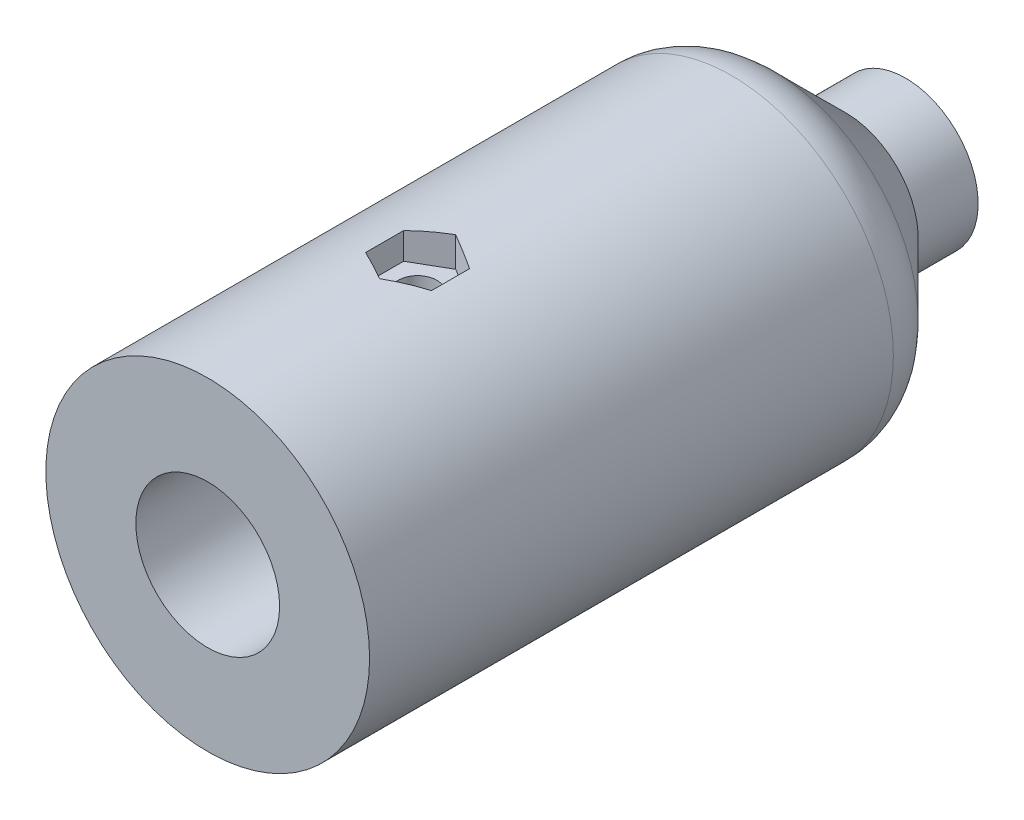
from build123d import *

# Parameters (mm, degrees)
SKETCH1_R                 = 11.05
SKETCH1_R_2               = 6.05
BOSS_EXTRUDE1_DEPTH       = 10
SKETCH2_R                 = 6.05
BOSS_EXTRUDE2_DEPTH       = 15
BOSS_EXTRUDE3_START       = 5
SKETCH3_R                 = 11.05
BOSS_EXTRUDE3_DEPTH       = 5
CHAMFER1_SIZE             = 5
SKETCH4_R                 = 6.05
SKETCH4_R_2               = 5.995
BOSS_EXTRUDE4_DEPTH       = 10
SKETCH5_R                 = 11.05
SKETCH5_R_2               = 5.995
BOSS_EXTRUDE5_DEPTH       = 28.2
SKETCH6_R                 = 11.05
BOSS_EXTRUDE6_DEPTH       = 18.2
CUT_EXTRUDE1_DEPTH        = 2.5
SKETCH8_R                 = 2.1
CUT_EXTRUDE2_DEPTH        = 56.44767804
SKETCH9_R                 = 2.8
CUT_EXTRUDE3_DEPTH        = 3.2
CUT_EXTRUDE4_START        = -3.2
SKETCH10_R                = 6.05
CUT_EXTRUDE4_DEPTH        = 3.2
CUT_EXTRUDE5_START        = -1.8
SKETCH11_R                = 6.05
CUT_EXTRUDE5_DEPTH        = 1.8
CUT_EXTRUDE6_DEPTH        = 42.272811874
CUT_EXTRUDE6_DEPTH_BACK   = 42.272811874
CUT_EXTRUDE7_START        = 8.5
CUT_EXTRUDE7_OUTLINE_R    = 1.6
CUT_EXTRUDE7_DEPTH        = 2.55
CUT_EXTRUDE8_START        = -11.050000102
CUT_EXTRUDE8_OUTLINE_R    = 2.75
CUT_EXTRUDE8_OUTLINE_R_2  = 1.6
CUT_EXTRUDE8_DEPTH        = 2.550000102
BOSS_EXTRUDE8_REACH       = 52.67
SKETCH15_R                = 13.5
SKETCH15_R_2              = 5.995
CUT_EXTRUDE9_DEPTH        = 43.705269085
CUT_EXTRUDE9_DEPTH_BACK   = 43.705269085
CUT_EXTRUDE10_START       = 11
CUT_EXTRUDE10_OUTLINE_R   = 1.6
CUT_EXTRUDE10_DEPTH       = 2.5
CUT_EXTRUDE11_START       = -13.500000102
CUT_EXTRUDE11_OUTLINE_R   = 2.75
CUT_EXTRUDE11_OUTLINE_R_2 = 1.6
CUT_EXTRUDE11_DEPTH       = 2.500000102
FILLET3_R                 = 5
SKETCH16_R                = 13.5
SKETCH16_R_2              = 5.995
BOSS_EXTRUDE9_DEPTH       = 10
SKETCH17_R                = 5.995
BOSS_EXTRUDE10_DEPTH      = 1.8
SKETCH19_R                = 2.1
BOSS_EXTRUDE12_DEPTH      = 1.25


# Read off the part's stored shape, not the designer's step: Cut-Extrude7, Cut-Extrude8, Cut-Extrude10, Cut-Extrude11
with BuildPart() as part:
    # Sketch1 → Boss-Extrude1 (new body)
    with BuildSketch(Plane.XY):
        Circle(SKETCH1_R)
        Circle(SKETCH1_R_2, mode=Mode.SUBTRACT)
    extrude(amount=BOSS_EXTRUDE1_DEPTH)



with BuildPart() as body_2:
    # Sketch2 → Boss-Extrude2 (new body)
    with BuildSketch(Plane(origin=(0, 0, 0), x_dir=(-1, 0, 0), z_dir=(0, 0, -1))):
        with Locations(Location((0, 0, 0), (0, 0, 180))):
            Circle(SKETCH2_R)
    extrude(amount=BOSS_EXTRUDE2_DEPTH)


with BuildPart() as part_1:
    add(part.part)

    add(body_2.part)  # Boss-Extrude3 merges body 2
    # Sketch3 → Boss-Extrude3 (add)
    with BuildSketch(Plane(origin=(0, 0, 0), x_dir=(-1, 0, 0), z_dir=(0, 0, -1)).offset(BOSS_EXTRUDE3_START)):
        Circle(SKETCH3_R)
    extrude(amount=-BOSS_EXTRUDE3_DEPTH)

    # Chamfer1
    chamfer1_edges = [part_1.edges().sort_by_distance(p)[0] for p in [
        (11.05, 0, -5),
    ]]
    chamfer(chamfer1_edges, length=CHAMFER1_SIZE - 0.0001)  # a hair under: the kernel refuses the full size

    # Sketch4 → Boss-Extrude4 (add)
    with BuildSketch(Plane.XY.offset(10)):
        with Locations(Location((0, 0, 0), (0, 0, 180))):
            Circle(SKETCH4_R)
        Circle(SKETCH4_R_2, mode=Mode.SUBTRACT)
    extrude(amount=-BOSS_EXTRUDE4_DEPTH)

    # Sketch5 → Boss-Extrude5 (add)
    with BuildSketch(Plane.XY.offset(10)):
        with Locations(Location((0, 0, 0), (0, 0, 180))):
            Circle(SKETCH5_R)
        Circle(SKETCH5_R_2, mode=Mode.SUBTRACT)
    extrude(amount=BOSS_EXTRUDE5_DEPTH)

    # Sketch6 → Boss-Extrude6 (add)
    with BuildSketch(Plane.XY):
        with Locations(Location((0, 0, 0), (0, 0, 180))):
            Circle(SKETCH6_R)
    extrude(amount=BOSS_EXTRUDE6_DEPTH)

    # Sketch7 → Cut-Extrude1 (cut)
    with BuildSketch(Plane.XY.offset(18.2)):
        Polygon((0, 4.041451884), (-3.5, 2.020725942), (-3.5, -2.020725942), (0, -4.041451884), (3.5, -2.020725942), (3.5, 2.020725942), align=None)
    extrude(amount=-CUT_EXTRUDE1_DEPTH, mode=Mode.SUBTRACT)

    # Sketch8 → Cut-Extrude2 (cut, through all)
    with BuildSketch(Plane(origin=(0, 0, -15), x_dir=(-1, 0, 0), z_dir=(0, 0, -1))):
        Circle(SKETCH8_R)
    extrude(amount=-CUT_EXTRUDE2_DEPTH, mode=Mode.SUBTRACT)

    # Sketch9 → Cut-Extrude3 (cut)
    with BuildSketch(Plane(origin=(0, 0, -15), x_dir=(-1, 0, 0), z_dir=(0, 0, -1))):
        Circle(SKETCH9_R)
    extrude(amount=-CUT_EXTRUDE3_DEPTH, mode=Mode.SUBTRACT)

    # Sketch10 → Cut-Extrude4 (cut)
    with BuildSketch(Plane(origin=(0, 0, -15), x_dir=(-1, 0, 0), z_dir=(0, 0, -1)).offset(CUT_EXTRUDE4_START)):
        Circle(SKETCH10_R)
    extrude(amount=CUT_EXTRUDE4_DEPTH, mode=Mode.SUBTRACT)

    # Sketch11 → Cut-Extrude5 (cut)
    with BuildSketch(Plane(origin=(0, 0, -11.8), x_dir=(-1, 0, 0), z_dir=(0, 0, -1)).offset(CUT_EXTRUDE5_START)):
        Circle(SKETCH11_R)
    extrude(amount=CUT_EXTRUDE5_DEPTH, mode=Mode.SUBTRACT)

    # Sketch12 → Cut-Extrude6 (cut, two sides: drawn at the far end of the back side and taken through both)
    with BuildSketch(Plane(origin=(0, 0, 0), x_dir=(1, 0, 0), z_dir=(0, 1, 0)).offset(-CUT_EXTRUDE6_DEPTH_BACK)):
        with BuildLine():
            ThreePointArc((-1.6, -30.7), (-1.13137085, -31.83137085), (0, -32.3))
            Line((0, -32.3), (0, -30.7))
            Line((0, -30.7), (-1.6, -30.7))
        make_face()
        with BuildLine():
            Line((0, -30.7), (0, -32.3))
            ThreePointArc((0, -32.3), (1.13137085, -31.83137085), (1.6, -30.7))
            Line((1.6, -30.7), (0, -30.7))
        make_face()
        with BuildLine():
            ThreePointArc((0, -29.1), (-1.13137085, -29.56862915), (-1.6, -30.7))
            Line((-1.6, -30.7), (0, -30.7))
            Line((0, -30.7), (0, -29.1))
        make_face()
        with BuildLine():
            Line((0, -29.1), (0, -30.7))
            Line((0, -30.7), (1.6, -30.7))
            ThreePointArc((1.6, -30.7), (1.13137085, -29.56862915), (0, -29.1))
        make_face()
    extrude(amount=CUT_EXTRUDE6_DEPTH + CUT_EXTRUDE6_DEPTH_BACK, mode=Mode.SUBTRACT)

    # Cut-Extrude7 outline → Cut-Extrude7 (cut)
    with BuildSketch(Plane(origin=(0, 0, 0), x_dir=(1, 0, 0), z_dir=(0, 1, 0)).offset(CUT_EXTRUDE7_START)):
        Polygon((2.75, -29.11228676), (0, -27.524573519), (-2.75, -29.11228676), (-2.75, -32.28771324), (0, -33.875426481), (2.75, -32.28771324), align=None)
        with Locations((0, -30.7)):
            Circle(CUT_EXTRUDE7_OUTLINE_R, mode=Mode.SUBTRACT)
    extrude(amount=CUT_EXTRUDE7_DEPTH, mode=Mode.SUBTRACT)

    # Cut-Extrude8 outline → Cut-Extrude8 (cut)
    with BuildSketch(Plane(origin=(0, 0, 0), x_dir=(1, 0, 0), z_dir=(0, 1, 0)).offset(CUT_EXTRUDE8_START)):
        with Locations((0, -30.7)):
            Circle(CUT_EXTRUDE8_OUTLINE_R)
        with Locations((0, -30.7)):
            Circle(CUT_EXTRUDE8_OUTLINE_R_2, mode=Mode.SUBTRACT)
    extrude(amount=CUT_EXTRUDE8_DEPTH, mode=Mode.SUBTRACT)

    # Boss-Extrude8: up to this cone (the profile starts inside it)
    boss_extrude8_end = Plane(origin=(0, 0, 38.2), z_dir=(0, 0, 1)).offset(-49.249999) * Cone(1e-06, 151.67, 151.669999, align=(Align.CENTER, Align.CENTER, Align.MIN), mode=Mode.PRIVATE)
    # Sketch15 → Boss-Extrude8 (add, up to the surface)
    with BuildSketch(Plane.XY.offset(38.2), mode=Mode.PRIVATE) as boss_extrude8_sk1:
        Circle(SKETCH15_R)
        Circle(SKETCH15_R_2, mode=Mode.SUBTRACT)
    boss_extrude8_tool1 = extrude(boss_extrude8_sk1.sketch, amount=-BOSS_EXTRUDE8_REACH, mode=Mode.PRIVATE) & boss_extrude8_end
    add(boss_extrude8_tool1.solids().sort_by_distance((-13.118162, 0, 38.2))[0])

    # Sketch12<4> → Cut-Extrude9 (cut, two sides: drawn at the far end of the back side and taken through both)
    with BuildSketch(Plane(origin=(0, 0, 0), x_dir=(1, 0, 0), z_dir=(0, 1, 0)).offset(-CUT_EXTRUDE9_DEPTH_BACK)):
        with BuildLine():
            ThreePointArc((-1.6, -30.7), (-1.13137085, -31.83137085), (0, -32.3))
            Line((0, -32.3), (0, -30.7))
            Line((0, -30.7), (-1.6, -30.7))
        make_face()
        with BuildLine():
            Line((0, -30.7), (0, -32.3))
            ThreePointArc((0, -32.3), (1.13137085, -31.83137085), (1.6, -30.7))
            Line((1.6, -30.7), (0, -30.7))
        make_face()
        with BuildLine():
            ThreePointArc((0, -29.1), (-1.13137085, -29.56862915), (-1.6, -30.7))
            Line((-1.6, -30.7), (0, -30.7))
            Line((0, -30.7), (0, -29.1))
        make_face()
        with BuildLine():
            Line((0, -29.1), (0, -30.7))
            Line((0, -30.7), (1.6, -30.7))
            ThreePointArc((1.6, -30.7), (1.13137085, -29.56862915), (0, -29.1))
        make_face()
    extrude(amount=CUT_EXTRUDE9_DEPTH + CUT_EXTRUDE9_DEPTH_BACK, mode=Mode.SUBTRACT)

    # Cut-Extrude10 outline → Cut-Extrude10 (cut)
    with BuildSketch(Plane(origin=(0, 0, 0), x_dir=(1, 0, 0), z_dir=(0, 1, 0)).offset(CUT_EXTRUDE10_START)):
        Polygon((-2.75, -32.28771324), (0, -33.875426481), (2.75, -32.28771324), (2.75, -29.11228676), (0, -27.524573519), (-2.75, -29.11228676), align=None)
        with Locations((0, -30.7)):
            Circle(CUT_EXTRUDE10_OUTLINE_R, mode=Mode.SUBTRACT)
    extrude(amount=CUT_EXTRUDE10_DEPTH, mode=Mode.SUBTRACT)

    # Cut-Extrude11 outline → Cut-Extrude11 (cut)
    with BuildSketch(Plane(origin=(0, 0, 0), x_dir=(1, 0, 0), z_dir=(0, 1, 0)).offset(CUT_EXTRUDE11_START)):
        with Locations((0, -30.7)):
            Circle(CUT_EXTRUDE11_OUTLINE_R)
        with Locations((0, -30.7)):
            Circle(CUT_EXTRUDE11_OUTLINE_R_2, mode=Mode.SUBTRACT)
    extrude(amount=CUT_EXTRUDE11_DEPTH, mode=Mode.SUBTRACT)

    # Fillet3
    fillet3_edges = [part_1.edges().sort_by_distance(p)[0] for p in [
        (-13.5, 0, 2.45),
    ]]
    fillet(fillet3_edges, radius=FILLET3_R)

    # Sketch16 → Boss-Extrude9 (add)
    with BuildSketch(Plane.XY.offset(38.2)):
        Circle(SKETCH16_R)
        Circle(SKETCH16_R_2, mode=Mode.SUBTRACT)
    extrude(amount=BOSS_EXTRUDE9_DEPTH)

    # Sketch17 → Boss-Extrude10 (add)
    with BuildSketch(Plane.XY.offset(18.2)):
        Circle(SKETCH17_R)
        Polygon((0, 4.041451884), (-3.5, 2.020725942), (-3.5, -2.020725942), (0, -4.041451884), (3.5, -2.020725942), (3.5, 2.020725942), align=None, mode=Mode.SUBTRACT)
    extrude(amount=BOSS_EXTRUDE10_DEPTH)

    # Sketch19 → Boss-Extrude12 (add)
    with BuildSketch(Plane.XY.offset(15.7)):
        Polygon((0, 4.041451884), (-3.5, 2.020725942), (-3.5, -2.020725942), (0, -4.041451884), (3.5, -2.020725942), (3.5, 2.020725942), align=None)
        with Locations(Location((0, 0, 0), (0, 0, 180))):
            Circle(SKETCH19_R, mode=Mode.SUBTRACT)
    extrude(amount=BOSS_EXTRUDE12_DEPTH)


solid = part_1.part
